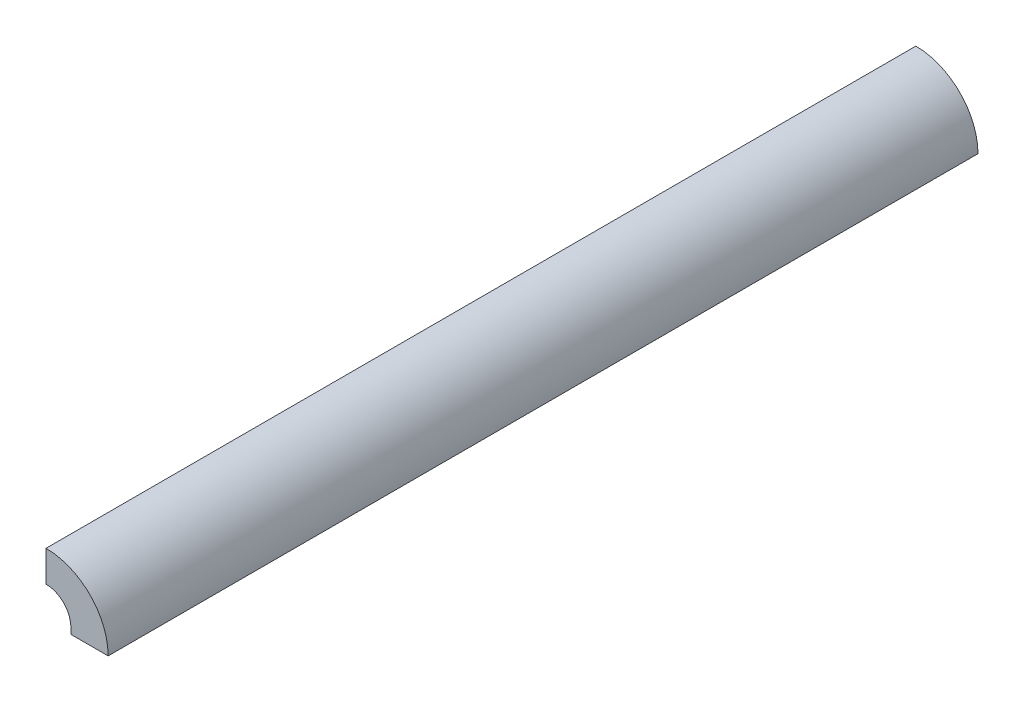
from build123d import *

# Parameters (mm, degrees)
BOSS_EXTRUDE1_DEPTH = 350
CUT_EXTRUDE1_DEPTH  = 10
FILLET1_R           = 10


with BuildPart() as part:
    # Sketch1 → Boss-Extrude1 (new body)
    with BuildSketch(Plane.XY):
        with BuildLine():
            Line((0, 0), (0, 25))
            ThreePointArc((0, 25), (17.67766953, 17.67766953), (25, 0))
            Line((25, 0), (0, 0))
        make_face()
    extrude(amount=BOSS_EXTRUDE1_DEPTH)

    # Sketch2 → Cut-Extrude1 (cut)
    with BuildSketch(Plane.ZY):
        with BuildLine():
            Line((350, 0), (350, 12.5))
            Line((350, 12.5), (208.071891388, 12.5))
            ThreePointArc((208.071891388, 12.5), (190.394221859, 9.270717335), (175, 0))
            Line((175, 0), (350, 0))
        make_face()
    extrude(amount=-CUT_EXTRUDE1_DEPTH, mode=Mode.SUBTRACT)

    # Fillet1
    fillet1_edges = [part.edges().sort_by_distance(p)[0] for p in [
        (10, 12.5, 279.035945694),
        (10, 9.270717335, 190.394221859),
    ]]
    fillet(fillet1_edges, radius=FILLET1_R - 0.0001)  # a hair under: the kernel refuses the full size


solid = part.part
